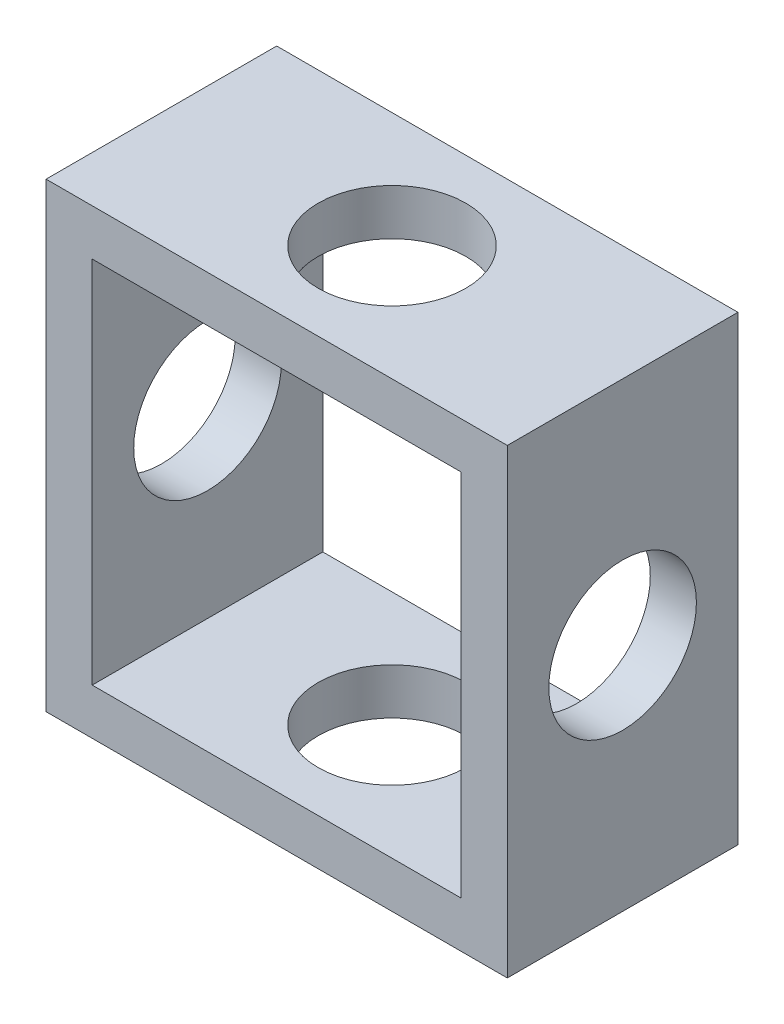
from build123d import *

# Parameters (mm, degrees)
CROQUIS1_W              = 50
CROQUIS1_H              = 50
CROQUIS1_W_2            = 40
CROQUIS1_H_2            = 40
SALIENTE_EXTRUIR1_DEPTH = 25
CROQUIS2_R              = 8
CORTAR_EXTRUIR1_DEPTH   = 60
CROQUIS3_R              = 8
CORTAR_EXTRUIR2_DEPTH   = 60


with BuildPart() as part:
    # Croquis1 → Saliente-Extruir1 (new body)
    with BuildSketch(Plane.XY):
        Rectangle(CROQUIS1_W, CROQUIS1_H)
        Rectangle(CROQUIS1_W_2, CROQUIS1_H_2, mode=Mode.SUBTRACT)
    extrude(amount=SALIENTE_EXTRUIR1_DEPTH)

    # Croquis2 → Cortar-Extruir1 (cut)
    with BuildSketch(Plane(origin=(0, 25, 0), x_dir=(1, 0, 0), z_dir=(0, 1, 0))):
        with Locations((0, -12.5)):
            Circle(CROQUIS2_R)
    extrude(amount=-CORTAR_EXTRUIR1_DEPTH, mode=Mode.SUBTRACT)

    # Croquis3 → Cortar-Extruir2 (cut)
    with BuildSketch(Plane(origin=(25, 0, 0), x_dir=(0, 0, -1), z_dir=(1, 0, 0))):
        with Locations((-12.5, 0)):
            Circle(CROQUIS3_R)
    extrude(amount=-CORTAR_EXTRUIR2_DEPTH, mode=Mode.SUBTRACT)


solid = part.part
